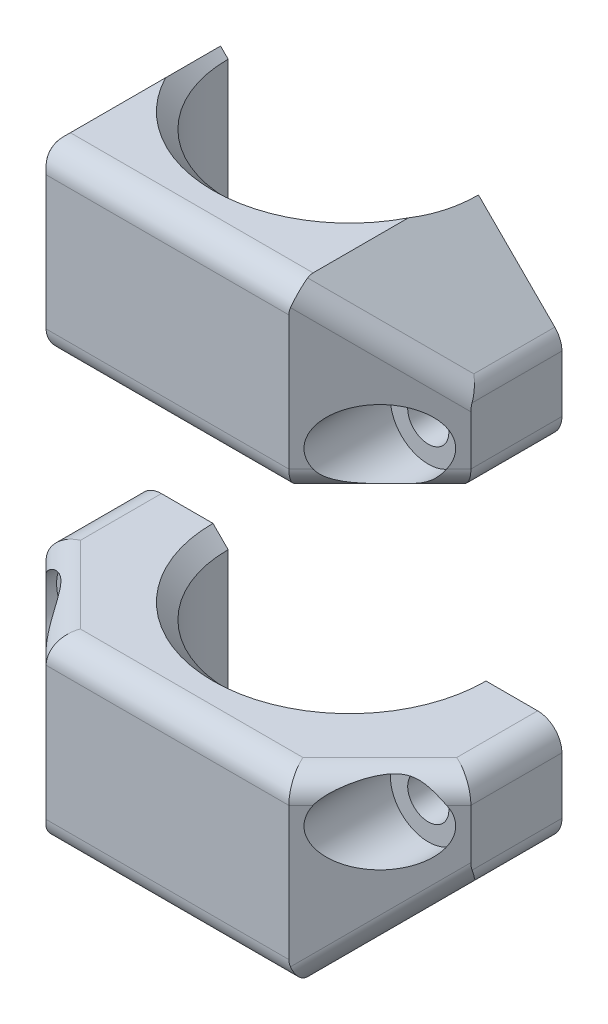
from build123d import *

# Parameters (mm, degrees)
BOSS_EXTRUDE1_DEPTH                         = 19.05
BOSS_EXTRUDE1_2_DEPTH                       = 19.05
CUT_EXTRUDE1_DEPTH                          = 70.922121857
CUT_EXTRUDE1_DEPTH_BACK                     = 70.922121857
SKETCH2_R                                   = 12.7
CHAMFER1_SIZE                               = 9.525
CHAMFER2_SIZE                               = 9.525
CHAMFER3_SIZE                               = 1.5875
CHAMFER4_SIZE                               = 1.5875
FILLET1_R                                   = 2.54
FILLET2_R                                   = 2.54
CBORE_FOR_6_BINDING_HEAD_MACHINE_SC_2_COUNT = 2
CBORE_FOR_6_BINDING_HEAD_MACHINE_SC_2_PITCH = 34.234947664
CBORE_FOR_6_BINDING_HEAD_MACHINE_SC_3_COUNT = 2
CBORE_FOR_6_BINDING_HEAD_MACHINE_SC_3_PITCH = 34.925
CBORE_FOR_6_BINDING_HEAD_MACHINE_SC_4_COUNT = 2
CBORE_FOR_6_BINDING_HEAD_MACHINE_SC_4_PITCH = 48.905902165


with BuildPart() as part:
    # Sketch1 → Boss-Extrude1 (new body)
    with BuildSketch(Plane.XY):
        Polygon((22.225, -12.7), (-22.225, -12.7), (-22.225, -22.225), (-12.7, -31.75), (12.7, -31.75), (22.225, -22.225), align=None)
    extrude(amount=BOSS_EXTRUDE1_DEPTH)


with BuildPart() as body_2:
    # Sketch1 → Boss-Extrude1 2 (new body)
    with BuildSketch(Plane.XY):
        Polygon((-22.225, 22.225), (-22.225, 12.7), (22.225, 12.7), (22.225, 22.225), (12.7, 31.75), (-12.7, 31.75), align=None)
    extrude(amount=BOSS_EXTRUDE1_2_DEPTH)


with BuildPart() as cut_extrude1_tool:
    # Sketch2 → Cut-Extrude1 (new, two sides: drawn at the far end of the back side and taken through both)
    with BuildSketch(Plane.ZX.offset(31.75).offset(-CUT_EXTRUDE1_DEPTH_BACK)):
        Circle(SKETCH2_R)
    extrude(amount=CUT_EXTRUDE1_DEPTH + CUT_EXTRUDE1_DEPTH_BACK)


with BuildPart() as part_1:
    add(part.part)

    # Cut-Extrude1: cut by cut_extrude1_tool
    add(cut_extrude1_tool.part, mode=Mode.SUBTRACT)

    # Chamfer2
    chamfer2_edges = [part_1.edges().sort_by_distance(p)[0] for p in [
        (22.225, -17.4625, 19.05),
        (-22.225, -17.4625, 19.05),
    ]]
    chamfer(chamfer2_edges, length=CHAMFER2_SIZE)

    # Chamfer3
    chamfer3_edges = [part_1.edges().sort_by_distance(p)[0] for p in [
        (0, -31.75, 12.7),
        (0, -12.7, 12.7),
    ]]
    chamfer(chamfer3_edges, length=CHAMFER3_SIZE)

    # Fillet1
    # the kernel refuses this fillet: 2.54 mm, written as the material it takes off along each edge
    with BuildSketch(Plane(origin=(-19.05, -31.75, 19.05), x_dir=(0, 1, 0), z_dir=(1, 0, 0))) as fillet1_piece_1:
        with BuildLine():
            CenterArc((FILLET1_R, -FILLET1_R), FILLET1_R, 90, 90)
            Line((0, -FILLET1_R), (0, 0))
            Line((0, 0), (FILLET1_R, 0))
        make_face()
    extrude(amount=38.1, mode=Mode.SUBTRACT)
    with BuildSketch(Plane(origin=(19.05, -12.7, 19.05), x_dir=(0, 0, -1), z_dir=(-1, 0, 0))) as fillet1_piece_2:
        with BuildLine():
            CenterArc((FILLET1_R, FILLET1_R), FILLET1_R, 180, 90)
            Line((0, FILLET1_R), (0, 0))
            Line((0, 0), (FILLET1_R, 0))
        make_face()
    extrude(amount=38.1, mode=Mode.SUBTRACT)
    with BuildSketch(Plane(origin=(-22.225, -12.7, -6.35), x_dir=(1, 0, 0), z_dir=(0, 0, 1))) as fillet1_piece_3:
        with BuildLine():
            CenterArc((FILLET1_R, -FILLET1_R), FILLET1_R, 90, 90)
            Line((0, -FILLET1_R), (0, 0))
            Line((0, 0), (FILLET1_R, 0))
        make_face()
    extrude(amount=22.225, mode=Mode.SUBTRACT)
    with BuildSketch(Plane(origin=(22.225, -12.7, -6.35), x_dir=(-1, 0, 0), z_dir=(0, 0, 1))) as fillet1_piece_4:
        with BuildLine():
            CenterArc((FILLET1_R, FILLET1_R), FILLET1_R, 180, 90)
            Line((0, FILLET1_R), (0, 0))
            Line((0, 0), (FILLET1_R, 0))
        make_face()
    extrude(amount=22.225, mode=Mode.SUBTRACT)
    with BuildSketch(Plane(origin=(-26.715128061, -12.7, 5.034871939), x_dir=(0.7071067811865475, 0, -0.7071067811865475), z_dir=(0.7071067811865476, 0, 0.7071067811865476)), Plane(origin=(8.209871939, -12.7, 23.540128061), x_dir=(-0.7071067811865476, 0, -0.7071067811865476), z_dir=(0.7071067811865476, 0, -0.7071067811865476))) as fillet1_piece_5:
        with BuildLine():
            CenterArc((FILLET1_R, -FILLET1_R), FILLET1_R, 90, 90)
            Line((0, -FILLET1_R), (0, 0))
            Line((0, 0), (FILLET1_R, 0))
        make_face()
    extrude(amount=26.170384182, mode=Mode.SUBTRACT)
    with BuildSketch(Plane(origin=(22.225, -22.225, -2.630256121), x_dir=(0, 1, 0), z_dir=(0, 0, 1))) as fillet1_piece_6:
        with BuildLine():
            CenterArc((FILLET1_R * 0.414213562373, FILLET1_R), FILLET1_R, 225, 45)
            Line((-FILLET1_R * 0.292893218813, FILLET1_R * 0.292893218813), (0, 0))
            Line((0, 0), (FILLET1_R * 0.414213562373, 0))
        make_face()
    extrude(amount=14.785512242, mode=Mode.SUBTRACT)
    with BuildSketch(Plane(origin=(10.583333333, -33.866666667, 21.166666667), x_dir=(-0.4082482904638614, 0.8164965809277265, 0.40824829046386385), z_dir=(0.5773502691896262, 0.5773502691896252, -0.577350269189626)), Plane(origin=(-24.341666667, -20.108333333, 7.408333333), x_dir=(0.4082482904638628, 0.8164965809277268, 0.4082482904638616), z_dir=(0.5773502691896265, -0.5773502691896246, 0.5773502691896263))) as fillet1_piece_7:
        with BuildLine():
            CenterArc((FILLET1_R * 0.57735026919, -FILLET1_R), FILLET1_R, 90, 60)
            Line((-FILLET1_R * 0.288675134595, -FILLET1_R * 0.5), (0, 0))
            Line((0, 0), (FILLET1_R * 0.57735026919, 0))
        make_face()
    extrude(amount=23.830132361, mode=Mode.SUBTRACT)
    with BuildSketch(Plane(origin=(-22.225, -22.225, -2.630256121), x_dir=(0, 1, 0), z_dir=(0, 0, 1))) as fillet1_piece_8:
        with BuildLine():
            CenterArc((FILLET1_R * 0.414213562373, -FILLET1_R), FILLET1_R, 90, 45)
            Line((-FILLET1_R * 0.292893218813, -FILLET1_R * 0.292893218813), (0, 0))
            Line((0, 0), (FILLET1_R * 0.414213562373, 0))
        make_face()
    extrude(amount=14.785512242, mode=Mode.SUBTRACT)


with BuildPart() as body_2_1:
    add(body_2.part)

    # Cut-Extrude1: cut by cut_extrude1_tool
    add(cut_extrude1_tool.part, mode=Mode.SUBTRACT)

    # Chamfer1
    chamfer1_edges = [body_2_1.edges().sort_by_distance(p)[0] for p in [
        (22.225, 17.4625, 19.05),
        (-22.225, 17.4625, 19.05),
    ]]
    chamfer(chamfer1_edges, length=CHAMFER1_SIZE)

    # Chamfer4
    chamfer4_edges = [body_2_1.edges().sort_by_distance(p)[0] for p in [
        (0, 12.7, 12.7),
        (0, 31.75, 12.7),
    ]]
    chamfer(chamfer4_edges, length=CHAMFER4_SIZE)

    # Fillet2
    # the kernel refuses this fillet: 2.54 mm, written as the material it takes off along each edge
    with BuildSketch(Plane(origin=(-19.05, 12.7, 19.05), x_dir=(0, 0, -1), z_dir=(1, 0, 0)), Plane(origin=(19.05, 31.75, 19.05), x_dir=(0, 0, -1), z_dir=(-1, 0, 0))) as fillet2_piece_1:
        with BuildLine():
            CenterArc((FILLET2_R, FILLET2_R), FILLET2_R, 180, 90)
            Line((0, FILLET2_R), (0, 0))
            Line((0, 0), (FILLET2_R, 0))
        make_face()
    extrude(amount=38.1, mode=Mode.SUBTRACT)
    with BuildSketch(Plane(origin=(22.225, 22.225, -2.630256121), x_dir=(-0.7071067811865492, 0.7071067811865458, 0), z_dir=(0, 0, 1))) as fillet2_piece_2:
        with BuildLine():
            CenterArc((FILLET2_R * 0.414213562373, FILLET2_R), FILLET2_R, 225, 45)
            Line((-FILLET2_R * 0.292893218813, FILLET2_R * 0.292893218813), (0, 0))
            Line((0, 0), (FILLET2_R * 0.414213562373, 0))
        make_face()
    extrude(amount=14.785512242, mode=Mode.SUBTRACT)
    with BuildSketch(Plane(origin=(10.583333333, 33.866666667, 21.166666667), x_dir=(-0.4082482904638657, 0.4082482904638608, -0.8164965809277257), z_dir=(0.5773502691896262, -0.5773502691896251, -0.5773502691896262)), Plane(origin=(-24.341666667, 20.108333333, 7.408333333), x_dir=(0.4082482904638632, 0.4082482904638632, -0.8164965809277258), z_dir=(0.5773502691896257, 0.5773502691896256, 0.577350269189626))) as fillet2_piece_3:
        with BuildLine():
            CenterArc((FILLET2_R * 0.57735026919, -FILLET2_R), FILLET2_R, 90, 60)
            Line((-FILLET2_R * 0.288675134595, -FILLET2_R * 0.5), (0, 0))
            Line((0, 0), (FILLET2_R * 0.57735026919, 0))
        make_face()
    extrude(amount=23.830132361, mode=Mode.SUBTRACT)
    with BuildSketch(Plane(origin=(22.225, 12.7, -6.35), x_dir=(-1, 0, 0), z_dir=(0, 0, 1)), Plane(origin=(-22.225, 12.7, -6.35), x_dir=(0, 1, 0), z_dir=(0, 0, 1))) as fillet2_piece_4:
        with BuildLine():
            CenterArc((FILLET2_R, -FILLET2_R), FILLET2_R, 90, 90)
            Line((0, -FILLET2_R), (0, 0))
            Line((0, 0), (FILLET2_R, 0))
        make_face()
    extrude(amount=22.225, mode=Mode.SUBTRACT)
    with BuildSketch(Plane(origin=(-26.715128061, 12.7, 5.034871939), x_dir=(0, 1, 0), z_dir=(0.7071067811865476, 0, 0.7071067811865476))) as fillet2_piece_5:
        with BuildLine():
            CenterArc((FILLET2_R, -FILLET2_R), FILLET2_R, 90, 90)
            Line((0, -FILLET2_R), (0, 0))
            Line((0, 0), (FILLET2_R, 0))
        make_face()
    extrude(amount=26.170384182, mode=Mode.SUBTRACT)
    with BuildSketch(Plane(origin=(8.209871939, 12.7, 23.540128061), x_dir=(-0.7071067811865475, 0, -0.7071067811865475), z_dir=(0.7071067811865476, 0, -0.7071067811865476))) as fillet2_piece_6:
        with BuildLine():
            CenterArc((FILLET2_R, FILLET2_R), FILLET2_R, 180, 90)
            Line((0, FILLET2_R), (0, 0))
            Line((0, 0), (FILLET2_R, 0))
        make_face()
    extrude(amount=26.170384182, mode=Mode.SUBTRACT)
    with BuildSketch(Plane(origin=(-22.225, 22.225, -2.630256121), x_dir=(0.7071067811865476, 0.7071067811865476, 0), z_dir=(0, 0, 1))) as fillet2_piece_7:
        with BuildLine():
            CenterArc((FILLET2_R * 0.414213562373, -FILLET2_R), FILLET2_R, 90, 45)
            Line((-FILLET2_R * 0.292893218813, -FILLET2_R * 0.292893218813), (0, 0))
            Line((0, 0), (FILLET2_R * 0.414213562373, 0))
        make_face()
    extrude(amount=14.785512242, mode=Mode.SUBTRACT)

    # Sketch4 → CBORE for #6 Binding Head Machine Screw1 (revolve, cut)
    with BuildSketch(Plane(origin=(-17.4625, 17.117473832, 19.05), x_dir=(0, -1, 0), z_dir=(1, 0, 0))):
        Polygon((0, 0), (0, 23.645442612), (2.15265, 22.352), (2.15265, 9.8298), (3.96875, 9.8298), (3.96875, 0), align=None)
    cbore_for_6_binding_head_machine_screw1 = revolve(axis=Axis((-17.4625, 17.117473832, 25.4), (0, 0, -1)), mode=Mode.SUBTRACT)

    # CBORE for _6 Binding Head Machine Sc 3: CBORE for #6 Binding Head Machine Screw1 ×2
    with Locations(*[(i * CBORE_FOR_6_BINDING_HEAD_MACHINE_SC_3_PITCH, 0, 0) for i in range(1, CBORE_FOR_6_BINDING_HEAD_MACHINE_SC_3_COUNT)]):
        add(cbore_for_6_binding_head_machine_screw1, mode=Mode.SUBTRACT)


with BuildPart() as part_2:
    add(part_1.part)

    # CBORE for _6 Binding Head Machine Sc 2: CBORE for #6 Binding Head Machine Screw1 ×2
    with Locations(*[(0, -i * CBORE_FOR_6_BINDING_HEAD_MACHINE_SC_2_PITCH, 0) for i in range(1, CBORE_FOR_6_BINDING_HEAD_MACHINE_SC_2_COUNT)]):
        add(cbore_for_6_binding_head_machine_screw1, mode=Mode.SUBTRACT)

    # CBORE for _6 Binding Head Machine Sc 4: CBORE for #6 Binding Head Machine Screw1 ×2
    with Locations(*[Vector(0.7141264848198602, -0.7000166881430973, 0) * (i * CBORE_FOR_6_BINDING_HEAD_MACHINE_SC_4_PITCH) for i in range(1, CBORE_FOR_6_BINDING_HEAD_MACHINE_SC_4_COUNT)]):
        add(cbore_for_6_binding_head_machine_screw1, mode=Mode.SUBTRACT)


solid = Compound([body_2_1.part, part_2.part])
